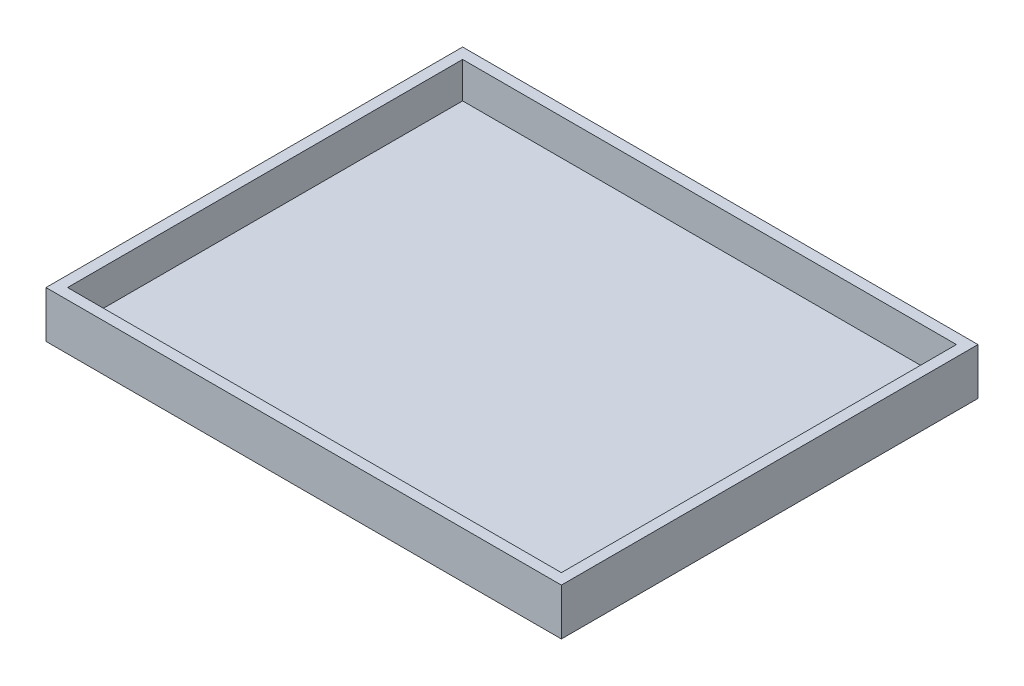
from build123d import *

# Parameters (mm, degrees)
SKETCH1_W           = 55
SKETCH1_H           = 44
BOSS_EXTRUDE1_DEPTH = 4
SHELL1_T            = 1.2


with BuildPart() as part:
    # Sketch1 → Boss-Extrude1 (new body)
    with BuildSketch(Plane(origin=(0, 0, 0), x_dir=(1, 0, 0), z_dir=(0, 1, 0))):
        with Locations((27.5, -22)):
            Rectangle(SKETCH1_W, SKETCH1_H)
    extrude(amount=BOSS_EXTRUDE1_DEPTH)

    # Shell1
    shell1_openings = [part.faces().sort_by_distance(p)[0] for p in [
        (27.5, 4, 22),
    ]]
    offset(amount=SHELL1_T, openings=shell1_openings, kind=Kind.INTERSECTION)


solid = part.part
